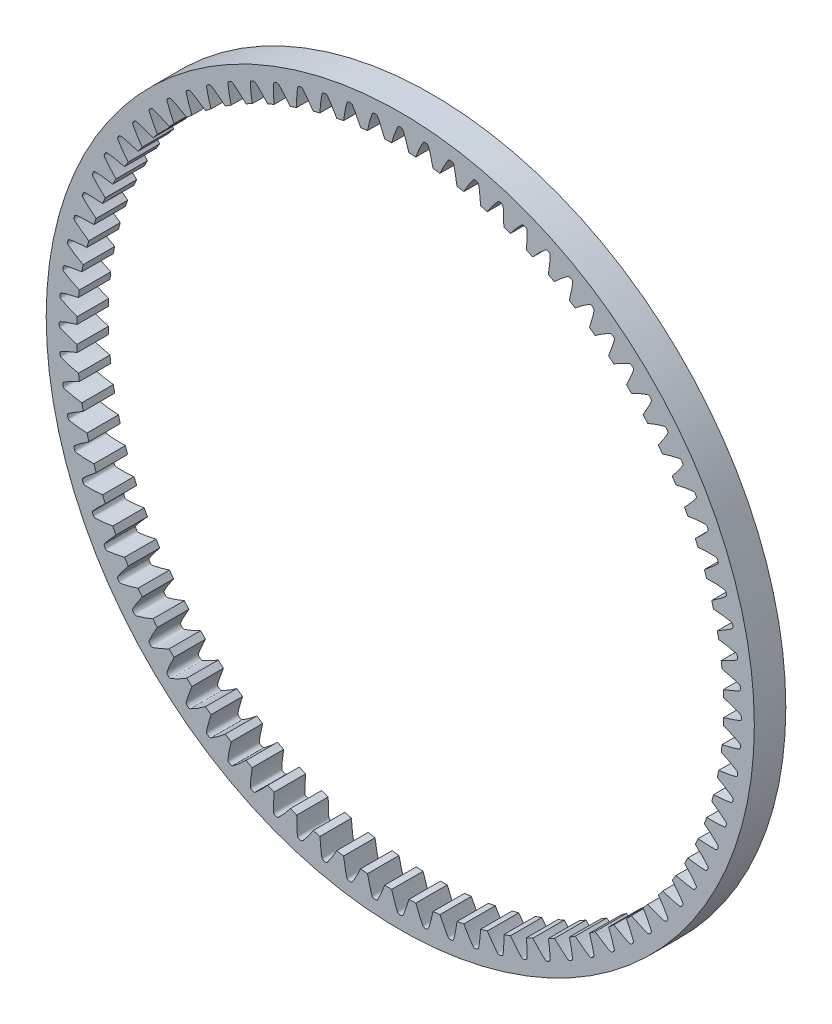
from build123d import *

# Parameters (mm, degrees)
SKETCHREVOLVESPURGEAR_W       = 4
SKETCHREVOLVESPURGEAR_H       = 3.899999985
TOOTHEXTRUDECUTSPURGEAR_DEPTH = 2
PATTERNSPURGEAR_COUNT         = 84


with BuildPart() as part:
    # SketchRevolveSpurGear → SpurGear (revolve)
    with BuildSketch(Plane(origin=(0, 0, 0), x_dir=(0, 0, -1), z_dir=(1, 0, 0))):
        with Locations((0, 43.049999376)):
            Rectangle(SKETCHREVOLVESPURGEAR_W, SKETCHREVOLVESPURGEAR_H)
    revolve(axis=Axis((0, 0, 0), (0, 0, -1)))

    # SketchToothSpurGear → ToothExtrudeCutSpurGear (cut, symmetric)
    with BuildSketch(Plane.XY):
        with BuildLine():
            ThreePointArc((41.053274955, -1.104782671), (41.068137641, 0), (41.053274955, 1.104782671))
            add(Edge.make_bspline(
                [(41.053274955, 1.104782671), (41.173440083, 1.073681302), (41.357525593, 1.022819055), (41.607443122, 0.947609302), (41.807634448, 0.883955675), (42.015863613, 0.814153804), (42.232003143, 0.737981156), (42.455833347, 0.65500752), (42.687468964, 0.565641754), (42.925671348, 0.466990094), (43.102470502, 0.397517193), (43.20905776, 0.345131496), (43.244497979, 0.318896296), (43.275672005, 0.288441449), (43.30208152, 0.253716049), (43.323154403, 0.215550628), (43.343705527, 0.161648317), (43.350911532, 0.103342135), (43.34977389, 0.044953022), (43.350112081, 0), (43.34977389, -0.044953022), (43.350911532, -0.103342135), (43.343705527, -0.161648317), (43.323154403, -0.215550628), (43.30208152, -0.253716049), (43.275672005, -0.288441449), (43.244497979, -0.318896296), (43.20905776, -0.345131496), (43.102470502, -0.397517193), (42.925671348, -0.466990094), (42.687468964, -0.565641754), (42.455833347, -0.65500752), (42.232003143, -0.737981156), (42.015863613, -0.814153804), (41.807634448, -0.883955675), (41.607443122, -0.947609302), (41.357525593, -1.022819055), (41.173440083, -1.073681302), (41.053274955, -1.104782671)],
                knots=[0, 0, 0, 0, 0.069441136, 0.106833076, 0.14600593, 0.186959699, 0.229694382, 0.274209979, 0.320506491, 0.368583917, 0.418442257, 0.426778118, 0.434882596, 0.442987073, 0.451091551, 0.459196029, 0.467300507, 0.483237277, 0.491618643, 0.5, 0.508381357, 0.516762723, 0.532699493, 0.540803971, 0.548908449, 0.557012927, 0.565117404, 0.573221882, 0.581557743, 0.631416083, 0.679493509, 0.725790021, 0.770305618, 0.813040301, 0.85399407, 0.893166924, 0.930558864, 1, 1, 1, 1], degree=3))
        make_face()
    toothextrudecutspurgear = extrude(amount=TOOTHEXTRUDECUTSPURGEAR_DEPTH, both=True, mode=Mode.SUBTRACT)

    # PatternSpurGear: ToothExtrudeCutSpurGear ×84 about axis
    patternspurgear_axis = Axis((0, 0, 55), (0, 0, -1))
    for i in range(1, PATTERNSPURGEAR_COUNT):
        add(toothextrudecutspurgear.rotate(patternspurgear_axis, i * 360 / PATTERNSPURGEAR_COUNT), mode=Mode.SUBTRACT)


solid = part.part
